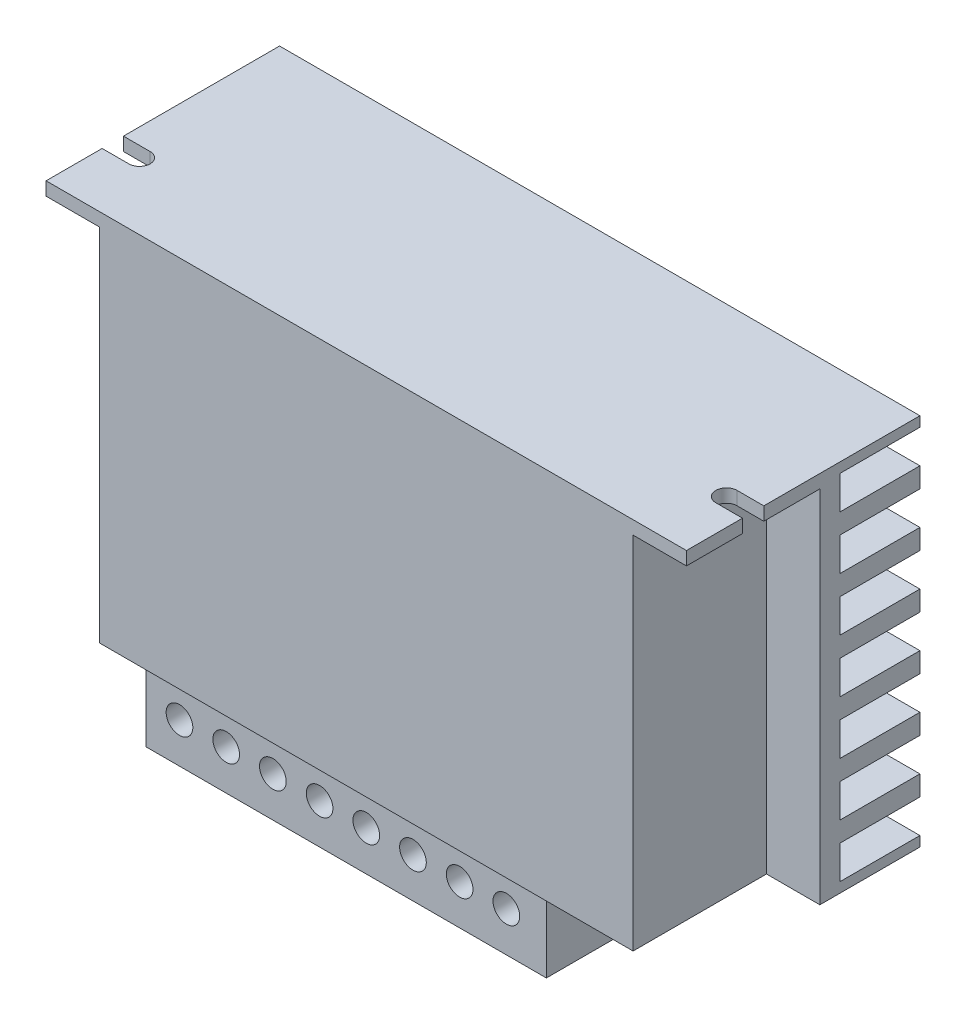
from build123d import *

# Parameters (mm, degrees)
SKETCH_1_W          = 96
SKETCH_1_H          = 56
EXTRUDE_1_DEPTH     = 35
SKETCH_5_W          = 20
SKETCH_5_H          = 54
CUT_EXTRUDE_3_DEPTH = 8
SKETCH_6_W          = 20
SKETCH_6_H          = 54
CUT_EXTRUDE_4_DEPTH = 8
SKETCH_7_W          = 12
SKETCH_7_H          = 5
CUT_EXTRUDE_5_DEPTH = 117.520384483
CUT_EXTRUDE_7_DEPTH = 116.572488076
SKETCH_9_W          = 60
SKETCH_9_H          = 15
EXTRUDE_2_DEPTH     = 12
SKETCH_10_R         = 2
CUT_EXTRUDE_8_DEPTH = 3


with BuildPart() as part:
    # Эскиз1 → Бобышка-Вытянуть1 (new body)
    with BuildSketch(Plane.XY):
        with Locations((48, 28)):
            Rectangle(SKETCH_1_W, SKETCH_1_H)
    extrude(amount=EXTRUDE_1_DEPTH)

    # Эскиз5 → Вырез-Вытянуть3 (cut)
    with BuildSketch(Plane(origin=(96, 0, 0), x_dir=(0, 0, -1), z_dir=(1, 0, 0))):
        with Locations((-25, 27)):
            Rectangle(SKETCH_5_W, SKETCH_5_H)
    extrude(amount=-CUT_EXTRUDE_3_DEPTH, mode=Mode.SUBTRACT)

    # Эскиз6 → Вырез-Вытянуть4 (cut)
    with BuildSketch(Plane.ZY):
        with Locations((25, 27)):
            Rectangle(SKETCH_6_W, SKETCH_6_H)
    extrude(amount=-CUT_EXTRUDE_4_DEPTH, mode=Mode.SUBTRACT)

    # Эскиз7 → Вырез-Вытянуть5 (cut, through all)
    with BuildSketch(Plane(origin=(96, 0, 0), x_dir=(0, 0, -1), z_dir=(1, 0, 0))):
        with Locations((-6, 4)):
            Rectangle(SKETCH_7_W, SKETCH_7_H)
        with Locations((-6, 12)):
            Rectangle(SKETCH_7_W, SKETCH_7_H)
        with Locations((-6, 20)):
            Rectangle(SKETCH_7_W, SKETCH_7_H)
        with Locations((-6, 28)):
            Rectangle(SKETCH_7_W, SKETCH_7_H)
        with Locations((-6, 36)):
            Rectangle(SKETCH_7_W, SKETCH_7_H)
        with Locations((-6, 44)):
            Rectangle(SKETCH_7_W, SKETCH_7_H)
        with Locations((-6, 52)):
            Rectangle(SKETCH_7_W, SKETCH_7_H)
    extrude(amount=-CUT_EXTRUDE_5_DEPTH, mode=Mode.SUBTRACT)

    # Эскиз8 → Вырез-Вытянуть7 (cut, through all)
    with BuildSketch(Plane.XZ.offset(-54)):
        with BuildLine():
            Line((96, 26.6), (92, 26.6))
            ThreePointArc((92, 26.6), (90.4, 25), (92, 23.4))
            Line((92, 23.4), (96, 23.4))
            Line((96, 23.4), (96, 26.6))
        make_face()
        with BuildLine():
            Line((0, 23.4), (4, 23.4))
            ThreePointArc((4, 23.4), (5.6, 25), (4, 26.6))
            Line((4, 26.6), (0, 26.6))
            Line((0, 26.6), (0, 23.4))
        make_face()
    extrude(amount=-CUT_EXTRUDE_7_DEPTH, mode=Mode.SUBTRACT)

    # Эскиз9 → Бобышка-Вытянуть2 (add)
    with BuildSketch(Plane.XZ):
        with Locations((43, 25.5)):
            Rectangle(SKETCH_9_W, SKETCH_9_H)
    extrude(amount=EXTRUDE_2_DEPTH)

    # Эскиз10 → Вырез-Вытянуть8 (cut)
    with BuildSketch(Plane.XY.offset(33)):
        with Locations((18, -6)):
            Circle(SKETCH_10_R)
        with Locations((25, -6)):
            Circle(SKETCH_10_R)
        with Locations((32, -6)):
            Circle(SKETCH_10_R)
        with Locations((39, -6)):
            Circle(SKETCH_10_R)
        with Locations((46, -6)):
            Circle(SKETCH_10_R)
        with Locations((53, -6)):
            Circle(SKETCH_10_R)
        with Locations((60, -6)):
            Circle(SKETCH_10_R)
        with Locations((67, -6)):
            Circle(SKETCH_10_R)
    extrude(amount=-CUT_EXTRUDE_8_DEPTH, mode=Mode.SUBTRACT)


solid = part.part
